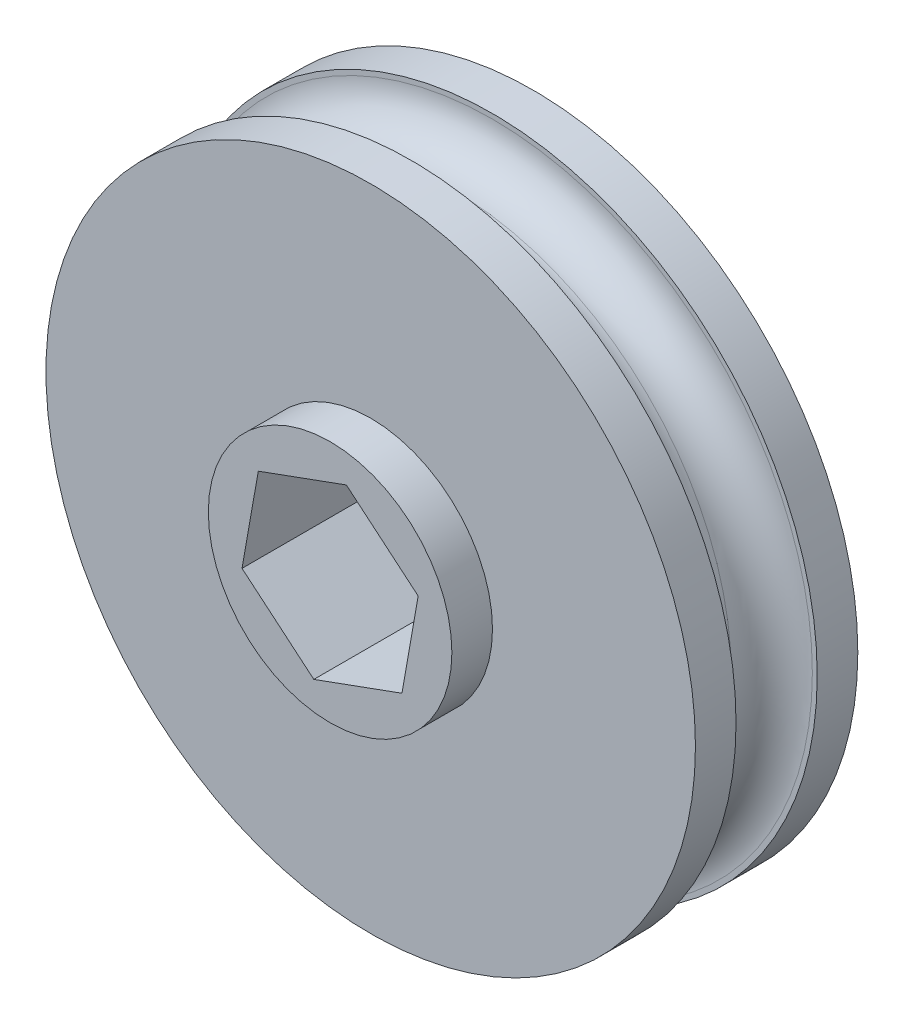
from build123d import *

# Parameters (mm, degrees)
SKETCH1_R           = 25.4
BOSS_EXTRUDE1_DEPTH = 12.7
CUT_EXTRUDE1_START  = -6.35
SKETCH2_R           = 25.4
SKETCH2_R_2         = 21.844
CUT_EXTRUDE1_DEPTH  = 6.35
FILLET1_R           = 3.175
CUT_EXTRUDE4_DEPTH  = 12.7
SKETCH6_R           = 9.525
BOSS_EXTRUDE4_DEPTH = 3.175


with BuildPart() as part:
    # Sketch1 → Boss-Extrude1 (new body)
    with BuildSketch(Plane.XY):
        Circle(SKETCH1_R)
    extrude(amount=BOSS_EXTRUDE1_DEPTH)

    # Sketch2 → Cut-Extrude1 (cut)
    with BuildSketch(Plane.XY.offset(9.525).offset(CUT_EXTRUDE1_START)):
        Circle(SKETCH2_R)
        Circle(SKETCH2_R_2, mode=Mode.SUBTRACT)
    extrude(amount=CUT_EXTRUDE1_DEPTH, mode=Mode.SUBTRACT)

    # Fillet1
    fillet1_edges = [part.edges().sort_by_distance(p)[0] for p in [
        (-21.844, 0, 3.175),
        (-21.844, 0, 9.525),
    ]]
    fillet(fillet1_edges, radius=FILLET1_R - 0.0001)  # a hair under: the kernel refuses the full size

    # Sketch3 → Cut-Extrude4 (cut)
    with BuildSketch(Plane.XY.offset(12.7)):
        Polygon((-1.272676276, -7.221054523), (5.617278521, -4.712697248), (6.889954797, 2.508357276), (1.272676276, 7.221054523), (-5.617278521, 4.712697248), (-6.889954797, -2.508357276), align=None)
    extrude(amount=-CUT_EXTRUDE4_DEPTH, mode=Mode.SUBTRACT)

    # Sketch6 → Boss-Extrude4 (add)
    with BuildSketch(Plane.XY.offset(12.7)):
        Circle(SKETCH6_R)
        Polygon((-1.272676276, -7.221054523), (5.617278521, -4.712697248), (6.889954797, 2.508357276), (1.272676276, 7.221054523), (-5.617278521, 4.712697248), (-6.889954797, -2.508357276), align=None, mode=Mode.SUBTRACT)
    extrude(amount=BOSS_EXTRUDE4_DEPTH)


solid = part.part
